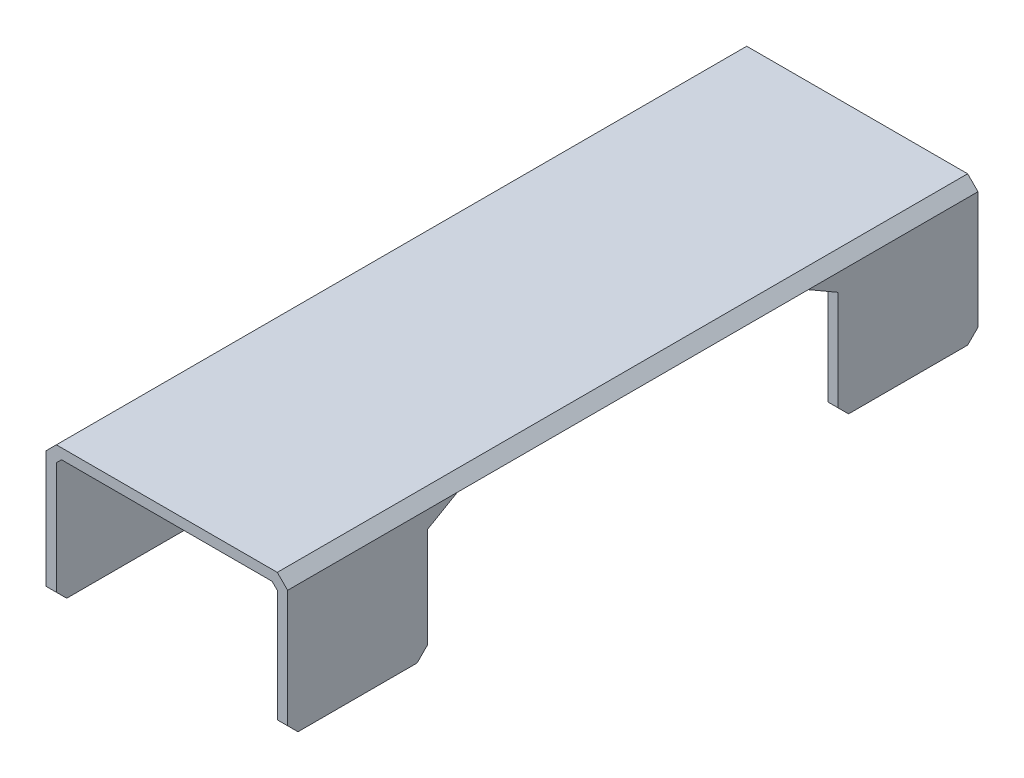
from build123d import *
from OCP.BRepFilletAPI import BRepFilletAPI_MakeChamfer

# Parameters (mm, degrees)
SKETCH2_W           = 64
SKETCH2_H           = 200
BOSS_EXTRUDE1_DEPTH = 3
SKETCH13_W          = 3
SKETCH13_H          = 40
BOSS_EXTRUDE2_DEPTH = 200
CHAMFER1_SIZE       = 1.5
CHAMFER2_SIZE       = 3
CUT_EXTRUDE1_REACH  = 129.55
SKETCH14_W          = 119
SKETCH14_H          = 37
CHAMFER3_SIZE       = 8.660254038
CHAMFER3_SIZE_2     = 5
CHAMFER4_SIZE       = 3


with BuildPart() as part:
    # Sketch2 → Boss-Extrude1 (new body)
    with BuildSketch(Plane(origin=(0, 0, 0), x_dir=(1, 0, 0), z_dir=(0, 1, 0))):
        Rectangle(SKETCH2_W, SKETCH2_H)
    extrude(amount=BOSS_EXTRUDE1_DEPTH)

    # Sketch13 → Boss-Extrude2 (add)
    with BuildSketch(Plane.XY.offset(100)):
        with Locations((33.5, -17)):
            Rectangle(SKETCH13_W, SKETCH13_H)
        with Locations((-33.5, -17)):
            Rectangle(SKETCH13_W, SKETCH13_H)
    extrude(amount=-BOSS_EXTRUDE2_DEPTH)

    # Chamfer1
    chamfer1_edges = [part.edges().sort_by_distance(p)[0] for p in [
        (-32, 0, 0),
        (32, 0, 0),
    ]]
    chamfer(chamfer1_edges, length=CHAMFER1_SIZE)

    # Chamfer2
    chamfer2_edges = [part.edges().sort_by_distance(p)[0] for p in [
        (35, 3, 0),
        (-35, 3, 0),
    ]]
    chamfer(chamfer2_edges, length=CHAMFER2_SIZE)

    # Cut-Extrude1: up to this face of the body (flat: up to its plane)
    cut_extrude1_end = Plane(part.part.faces().sort_by_distance((-35, -18.5, 0))[0])
    # Sketch14 → Cut-Extrude1 (cut, up to the picked face)
    with BuildSketch(Plane(origin=(35, 0, 0), x_dir=(0, 0, -1), z_dir=(1, 0, 0)), mode=Mode.PRIVATE) as cut_extrude1_sk1:
        with Locations((0, -18.5)):
            Rectangle(SKETCH14_W, SKETCH14_H)
    cut_extrude1_tool1 = split(extrude(cut_extrude1_sk1.sketch, amount=-CUT_EXTRUDE1_REACH, mode=Mode.PRIVATE), bisect_by=cut_extrude1_end, keep=Keep.BOTH, mode=Mode.PRIVATE)
    add(cut_extrude1_tool1.solids().sort_by(Axis((35, -18.5, 0), (-1, 0, 0)))[0], mode=Mode.SUBTRACT)

    # Chamfer3
    chamfer3_edges_1 = [part.edges().sort_by_distance(p)[0] for p in [
        (32.75, 0, -59.5),
    ]]
    chamfer3_side_1 = [part.faces().sort_by_distance(p)[0] for p in [
        (32.75, 0, -59.4),
    ]]
    chamfer3_edges_2 = [part.edges().sort_by_distance(p)[0] for p in [
        (-32.75, 0, -59.5),
    ]]
    chamfer3_side_2 = [part.faces().sort_by_distance(p)[0] for p in [
        (-32.75, 0, -59.4),
    ]]
    chamfer3_edges_3 = [part.edges().sort_by_distance(p)[0] for p in [
        (32.75, 0, 59.5),
    ]]
    chamfer3_side_3 = [part.faces().sort_by_distance(p)[0] for p in [
        (32.75, 0, 59.4),
    ]]
    chamfer3_edges_4 = [part.edges().sort_by_distance(p)[0] for p in [
        (-32.75, 0, 59.5),
    ]]
    chamfer3_side_4 = [part.faces().sort_by_distance(p)[0] for p in [
        (-32.75, 0, 59.4),
    ]]
    chamfer3 = BRepFilletAPI_MakeChamfer(part.part.solid().wrapped)
    for e in chamfer3_edges_1:
        chamfer3.Add(CHAMFER3_SIZE - 0.0001, CHAMFER3_SIZE_2 - 0.0001, e.wrapped, chamfer3_side_1[0].wrapped)
    for e in chamfer3_edges_2:
        chamfer3.Add(CHAMFER3_SIZE - 0.0001, CHAMFER3_SIZE_2 - 0.0001, e.wrapped, chamfer3_side_2[0].wrapped)
    for e in chamfer3_edges_3:
        chamfer3.Add(CHAMFER3_SIZE - 0.0001, CHAMFER3_SIZE_2 - 0.0001, e.wrapped, chamfer3_side_3[0].wrapped)
    for e in chamfer3_edges_4:
        chamfer3.Add(CHAMFER3_SIZE - 0.0001, CHAMFER3_SIZE_2 - 0.0001, e.wrapped, chamfer3_side_4[0].wrapped)
    add(Compound.cast(chamfer3.Shape()), mode=Mode.REPLACE)  # a hair under: the kernel refuses the full size

    # Chamfer4
    chamfer4_edges = [part.edges().sort_by_distance(p)[0] for p in [
        (33.5, -37, 100),
        (33.5, -37, -100),
        (-33.5, -37, 100),
        (-33.5, -37, -100),
        (33.5, -37, -59.5),
        (-33.5, -37, 59.5),
        (-33.5, -37, -59.5),
        (33.5, -37, 59.5),
    ]]
    chamfer(chamfer4_edges, length=CHAMFER4_SIZE)


solid = part.part
